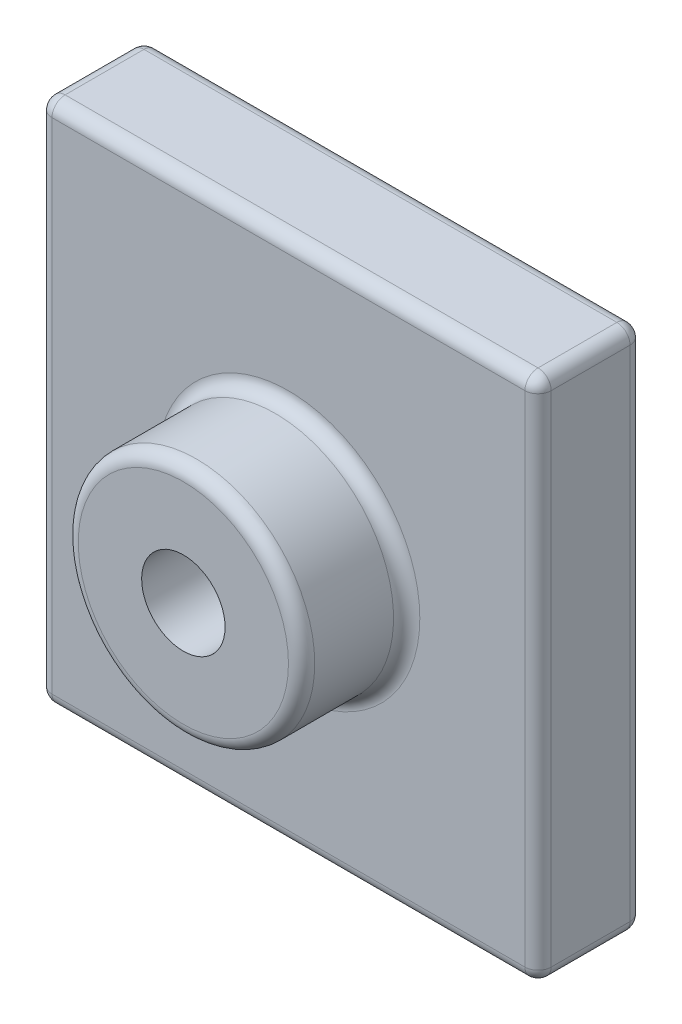
from build123d import *
from build123d.topology import SkipClean

# Parameters (mm, degrees)
SKETCH1_W           = 38
SKETCH1_H           = 40
BOSS_EXTRUDE1_DEPTH = 8
SKETCH2_R           = 9
SKETCH2_R_2         = 3.175
BOSS_EXTRUDE2_DEPTH = 8
FILLET1_R           = 1
CUT_EXTRUDE1_DEPTH  = 5.55625
SKETCH4_R           = 3.175
CUT_EXTRUDE2_DEPTH  = 58.445626465


with BuildPart() as part:
    # Sketch1 → Boss-Extrude1 (new body)
    with BuildSketch(Plane.XY):
        with Locations((19, 20)):
            Rectangle(SKETCH1_W, SKETCH1_H)
    extrude(amount=BOSS_EXTRUDE1_DEPTH)

    # Sketch2 → Boss-Extrude2 (add)
    with BuildSketch(Plane.XY.offset(8)):
        with Locations((19, 20)):
            Circle(SKETCH2_R)
        with Locations((19, 20)):
            Circle(SKETCH2_R_2, mode=Mode.SUBTRACT)
    extrude(amount=BOSS_EXTRUDE2_DEPTH)

    # Fillet1
    fillet1_edges = [part.edges().sort_by_distance(p)[0] for p in [
        (10, 20, 16),
        (19, 0, 0),
        (19, 40, 0),
        (38, 0, 4),
        (38, 40, 4),
        (38, 20, 0),
        (0, 40, 4),
        (0, 0, 4),
        (0, 20, 0),
        (10, 20, 8),
        (19, 40, 8),
        (38, 20, 8),
        (19, 0, 8),
        (0, 20, 8),
    ]]
    fillet(fillet1_edges, radius=FILLET1_R)

    # Sketch3 → Cut-Extrude1 (cut)
    with BuildSketch(Plane(origin=(0, 0, 0), x_dir=(-1, 0, 0), z_dir=(0, 0, -1))):
        Polygon((-17.166912895, 23.175), (-20.833087105, 23.175), (-22.666174209, 20), (-20.833087105, 16.825), (-17.166912895, 16.825), (-15.333825791, 20), align=None)
    extrude(amount=-CUT_EXTRUDE1_DEPTH, mode=Mode.SUBTRACT)

    # Sketch4 → Cut-Extrude2 (cut, through all)
    with SkipClean():  # the faces are left unmerged after this step: merging them gives an invalid solid
        with BuildSketch(Plane(origin=(0, 0, 0), x_dir=(-1, 0, 0), z_dir=(0, 0, -1))):
            with Locations((-19, 20)):
                Circle(SKETCH4_R)
        extrude(amount=-CUT_EXTRUDE2_DEPTH, mode=Mode.SUBTRACT)


solid = part.part
